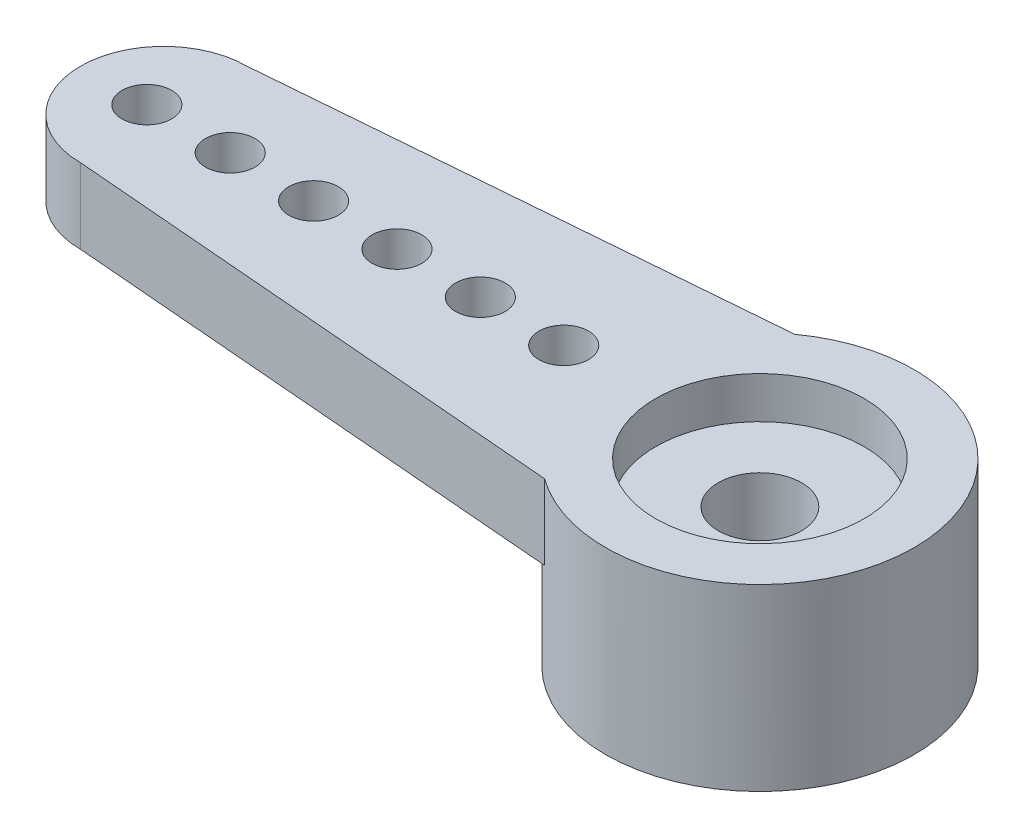
from build123d import *

# Parameters (mm, degrees)
CROQUIS1_R              = 3.7
SALIENTE_EXTRUIR2_DEPTH = 4.3
CROQUIS2_R              = 2.5
CORTAR_EXTRUIR1_DEPTH   = 1.5
CORTAR_EXTRUIR2_START   = -1
CROQUIS3_R              = 2.5
CORTAR_EXTRUIR2_DEPTH   = 1
CROQUIS4_R              = 1
CORTAR_EXTRUIR3_DEPTH   = 1.8
SALIENTE_EXTRUIR3_DEPTH = 1.8
CROQUIS6_R              = 0.595
CORTAR_EXTRUIR4_DEPTH   = 1.8


with BuildPart() as part:
    # Croquis1 → Saliente-Extruir2 (new body)
    with BuildSketch(Plane(origin=(0, 0, 0), x_dir=(1, 0, 0), z_dir=(0, 1, 0))):
        Circle(CROQUIS1_R)
    extrude(amount=SALIENTE_EXTRUIR2_DEPTH)

    # Croquis2 → Cortar-Extruir1 (cut)
    with BuildSketch(Plane.XZ):
        Circle(CROQUIS2_R)
    extrude(amount=-CORTAR_EXTRUIR1_DEPTH, mode=Mode.SUBTRACT)

    # Croquis3 → Cortar-Extruir2 (cut)
    with BuildSketch(Plane(origin=(0, 4.3, 0), x_dir=(1, 0, 0), z_dir=(0, 1, 0)).offset(CORTAR_EXTRUIR2_START)):
        Circle(CROQUIS3_R)
    extrude(amount=CORTAR_EXTRUIR2_DEPTH, mode=Mode.SUBTRACT)

    # Croquis4 → Cortar-Extruir3 (cut)
    with BuildSketch(Plane(origin=(0, 3.3, 0), x_dir=(1, 0, 0), z_dir=(0, 1, 0))):
        Circle(CROQUIS4_R)
    extrude(amount=-CORTAR_EXTRUIR3_DEPTH, mode=Mode.SUBTRACT)

    # Croquis5 → Saliente-Extruir3 (add)
    with BuildSketch(Plane(origin=(0, 4.3, 0), x_dir=(1, 0, 0), z_dir=(0, 1, 0))):
        with BuildLine():
            Line((-2.16564, 3.000000565), (-3.120237459, 0))
            Line((-3.120237459, 0), (-2.16564, -3.000000565))
            Line((-2.16564, -3.000000565), (-14.3, -2))
            ThreePointArc((-14.3, -2), (-16.3, 0), (-14.3, 2))
            Line((-14.3, 2), (-2.16564, 3.000000565))
        make_face()
    extrude(amount=-SALIENTE_EXTRUIR3_DEPTH)

    # Croquis6 → Cortar-Extruir4 (cut)
    with BuildSketch(Plane(origin=(0, 4.3, 0), x_dir=(1, 0, 0), z_dir=(0, 1, 0))):
        with Locations((-14.705, 0)):
            Circle(CROQUIS6_R)
        with Locations((-12.705, 0)):
            Circle(CROQUIS6_R)
        with Locations((-10.705, 0)):
            Circle(CROQUIS6_R)
        with Locations((-8.705, 0)):
            Circle(CROQUIS6_R)
        with Locations((-6.705, 0)):
            Circle(CROQUIS6_R)
        with Locations((-4.705, 0)):
            Circle(CROQUIS6_R)
    extrude(amount=-CORTAR_EXTRUIR4_DEPTH, mode=Mode.SUBTRACT)


solid = part.part
